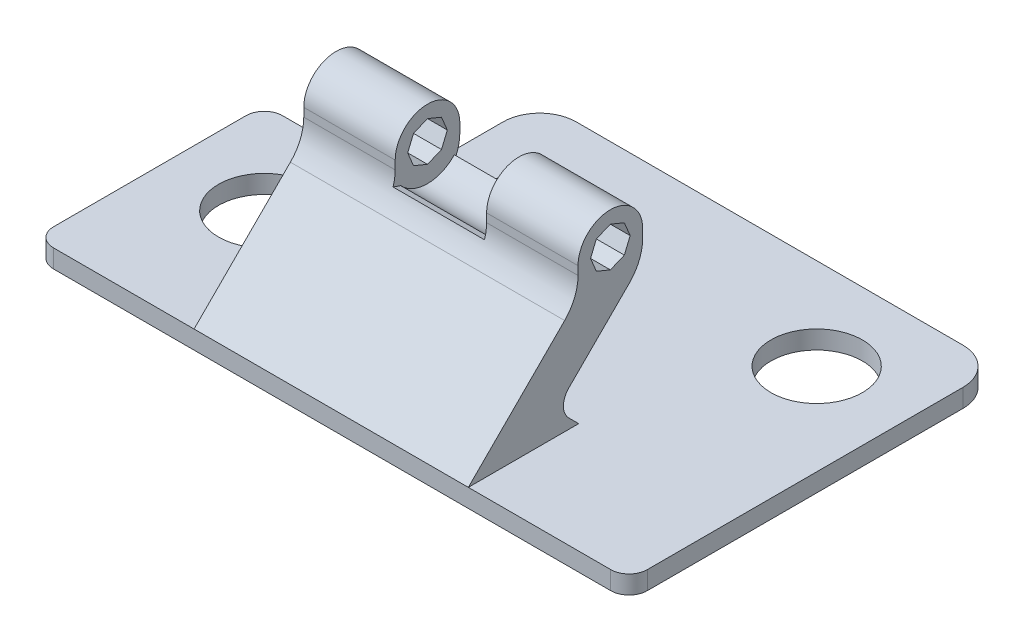
from build123d import *

# Parameters (mm, degrees)
BOSS_EXTRUDE2_DEPTH = 2
BOSS_EXTRUDE3_DEPTH = 15
CHAMFER1_SIZE       = 5
CHAMFER1_SIZE2      = 3.535533906
FILLET2_R           = 5
FILLET3_R           = 2
SKETCH6_R           = 5
CUT_EXTRUDE5_DEPTH  = 43.63874873
FILLET4_R           = 4
SKETCH4_R           = 4
CUT_EXTRUDE6_DEPTH  = 5


with BuildPart() as part:
    # Sketch1 → Boss-Extrude2 (new body)
    with BuildSketch(Plane(origin=(0, 0, 0), x_dir=(1, 0, 0), z_dir=(0, 1, 0))):
        with BuildLine():
            Line((-30.372025328, 4.851856012), (-20.222025328, 4.851856012))
            ThreePointArc((-20.222025328, 4.851856012), (-18.454258375, 5.584089059), (-17.722025328, 7.351856012))
            Line((-17.722025328, 7.351856012), (-17.722025328, 20.326643656))
            Line((-17.722025328, 20.326643656), (32.577974672, 20.326643656))
            Line((32.577974672, 20.326643656), (32.577974672, -18.198143988))
            ThreePointArc((32.577974672, -18.198143988), (31.992188234, -19.612357551), (30.577974672, -20.198143988))
            Line((30.577974672, -20.198143988), (-30.372025328, -20.198143988))
            ThreePointArc((-30.372025328, -20.198143988), (-31.78623889, -19.612357551), (-32.372025328, -18.198143988))
            Line((-32.372025328, -18.198143988), (-32.372025328, 2.851856012))
            ThreePointArc((-32.372025328, 2.851856012), (-31.78623889, 4.266069574), (-30.372025328, 4.851856012))
        make_face()
    extrude(amount=BOSS_EXTRUDE2_DEPTH)

    # Sketch2 → Boss-Extrude3 (add, symmetric)
    with BuildSketch(Plane(origin=(0, 0, 0), x_dir=(0, 0, -1), z_dir=(1, 0, 0))):
        with BuildLine():
            Line((-20.198143988, 2), (-8.198143988, 14))
            Line((-8.198143988, 14), (-8.198143988, 17))
            ThreePointArc((-8.198143988, 17), (-4.662610082, 20.535533906), (-1.127076177, 17))
            Line((-1.127076177, 17), (-1.127076177, 14))
            Line((-1.127076177, 14), (-13.127076177, 2))
            Line((-13.127076177, 2), (-20.198143988, 2))
        make_face()
        Polygon((-4.662610082, 14.835215599), (-3.131876353, 15.469266271), (-2.497825682, 17), (-3.131876353, 18.530733729), (-4.662610082, 19.164784401), (-6.193343812, 18.530733729), (-6.827394483, 17), (-6.193343812, 15.469266271), align=None, mode=Mode.SUBTRACT)
    extrude(amount=BOSS_EXTRUDE3_DEPTH, both=True)

    # Chamfer1
    chamfer1_edges = [part.edges().sort_by_distance(p)[0] for p in [
        (0, 2, 13.127076177),
    ]]
    chamfer1_side = [part.faces().sort_by_distance(p)[0] for p in [
        (2.715334419, 2, -0.404703372),
    ]]
    chamfer(chamfer1_edges, length=CHAMFER1_SIZE, length2=CHAMFER1_SIZE2, reference=chamfer1_side[0])

    # Fillet2
    fillet2_edges = [part.edges().sort_by_distance(p)[0] for p in [
        (0, 14, 1.127076177),
        (0, 14, 8.198143988),
    ]]
    fillet(fillet2_edges, radius=FILLET2_R)

    # Fillet3
    fillet3_edges = [part.edges().sort_by_distance(p)[0] for p in [
        (0, 4.5, 10.627076177),
    ]]
    fillet(fillet3_edges, radius=FILLET3_R)

    # Sketch6 → Cut-Extrude5 (cut, through all)
    with BuildSketch(Plane(origin=(0, 2, 0), x_dir=(1, 0, 0), z_dir=(0, 1, 0))):
        with Locations(Location((22.577974672, 10.326643656, 0), (0, 0, 270))):
            Circle(SKETCH6_R)
        with Locations(Location((-7.722025328, 10.326643656, 0), (0, 0, 270))):
            Circle(SKETCH6_R)
        with Locations(Location((-22.372025328, -5.148143988, 0), (0, 0, 270))):
            Circle(SKETCH6_R)
    extrude(amount=-CUT_EXTRUDE5_DEPTH, mode=Mode.SUBTRACT)

    # Fillet4
    fillet4_edges = [part.edges().sort_by_distance(p)[0] for p in [
        (-17.722025328, 1, -20.326643656),
        (32.577974672, 1, -20.326643656),
    ]]
    fillet(fillet4_edges, radius=FILLET4_R)

    # Sketch4 → Cut-Extrude6 (cut, symmetric)
    with BuildSketch(Plane(origin=(0, 0, 0), x_dir=(0, 0, -1), z_dir=(1, 0, 0))):
        with Locations((-4.662610082, 17)):
            Circle(SKETCH4_R)
    extrude(amount=CUT_EXTRUDE6_DEPTH, both=True, mode=Mode.SUBTRACT)

    # Chamfer2
    # the kernel refuses this chamfer: 1, 0.7919938 mm, written as the material it takes off along each edge
    with BuildSketch(Plane(origin=(-5, 14.878966184, 1.271265873), x_dir=(0, -0.9451293826533955, 0.3266962657350272), z_dir=(1, 0, 0))) as chamfer2_piece_1:
        with BuildLine():
            Line((0.919369635, 0), (0.720278223, -0.239594389))
            ThreePointArc((0.720278223, -0.239594389), (0.358867912, -0.100362012), (0, 0))
            ThreePointArc((0, 0), (0.472481659, 0.021159479), (0.919369635, 0))
        make_face()
    extrude(amount=10, mode=Mode.SUBTRACT)

    # Chamfer3
    # the kernel refuses this chamfer: 1, 0.717753161 mm, written as the material it takes off along each edge
    with BuildSketch(Plane(origin=(5, 15.260052087, 8.264357056), x_dir=(0, -0.8256881187536859, -0.5641268745140575), z_dir=(-1, 0, 0))) as chamfer3_piece_1:
        with BuildLine():
            Line((1.190375888, 0), (0.477865365, 0.526129749))
            ThreePointArc((0.477865365, 0.526129749), (0.246923946, 0.253056093), (0, 0))
            ThreePointArc((0, 0), (0.611506956, 0.044495651), (1.190375888, 0))
        make_face()
    extrude(amount=10, mode=Mode.SUBTRACT)


solid = part.part
